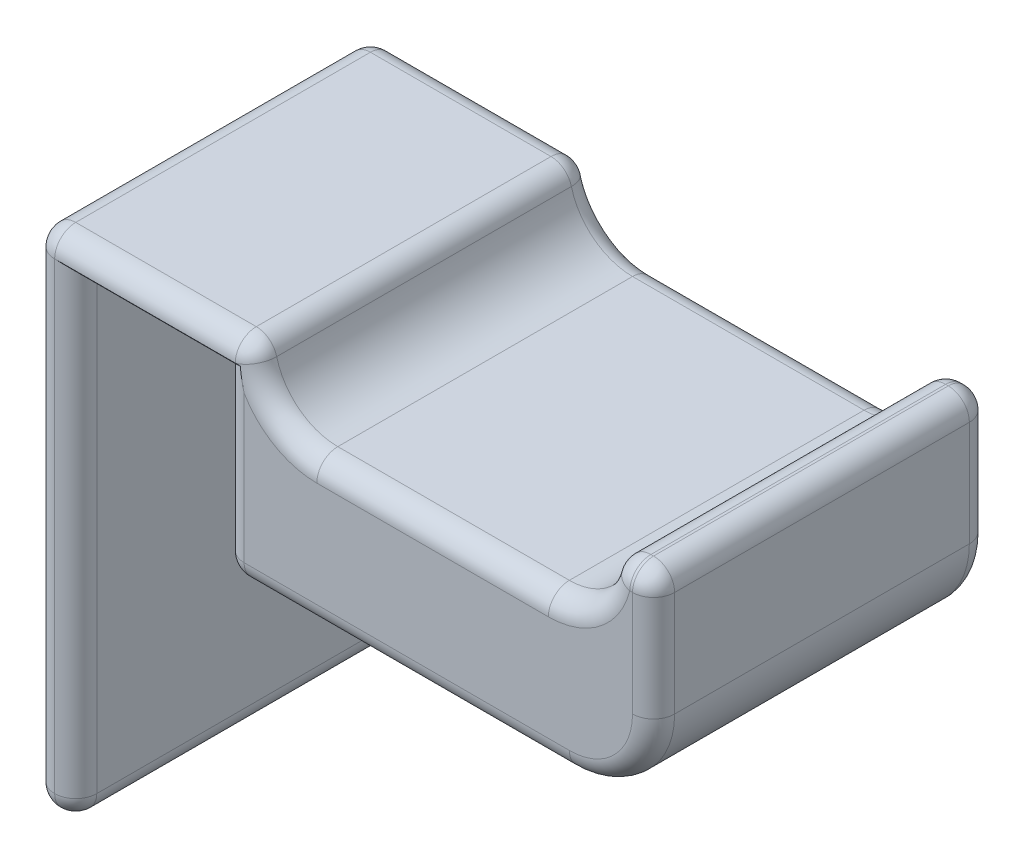
from build123d import *

# Parameters (mm, degrees)
BOSS_EXTRUDE1_DEPTH = 40
FILLET1_R           = 2.5
FILLET2_R           = 2.5
FILLET3_R           = 2.5


with BuildPart() as part:
    # Sketch1 → Boss-Extrude1 (new body)
    with BuildSketch(Plane.XY):
        with BuildLine():
            Line((2.5000000000000173, 0), (21.127950813884276, 0))
            Line((21.127950813884276, 0), (23.945492448365734, 0))
            ThreePointArc((23.945492448365734, 0), (25.47642353760522, -0.5235764623947627), (26.36610703974537, -1.8749999999999996))
            ThreePointArc((26.36610703974537, -1.8749999999999996), (29.035157546165816, -5.92927061281571), (33.627950813884276, -7.5))
            Line((33.627950813884276, -7.5), (61.1279508138843, -7.499999999999999))
            ThreePointArc((61.1279508138843, -7.499999999999999), (65.72074408160276, -5.92927061281571), (68.38979458802321, -1.874999999999998))
            ThreePointArc((68.38979458802321, -1.874999999999998), (69.27947809016335, -0.5235764623947716), (70.81040917940282, 0))
            Line((70.81040917940282, 0), (71.12795081388428, 0))
            ThreePointArc((71.12795081388428, 0), (72.89571776685065, -0.7322330470336298), (73.6279508138843, -2.499999999999995))
            Line((73.6279508138843, -2.499999999999995), (73.6279508138843, -15.000000000000004))
            ThreePointArc((73.6279508138843, -15.000000000000004), (70.69901862574977, -22.07106781186548), (63.6279508138843, -25.000000000000004))
            Line((63.6279508138843, -25.000000000000004), (25.00000000000001, -25.000000000000007))
            ThreePointArc((25.00000000000001, -25.000000000000007), (23.232233047033624, -24.267766952966376), (22.499999999999993, -22.49999999999999))
            Line((22.499999999999993, -22.49999999999999), (22.500000000000004, -3.4999999999999987))
            Line((22.500000000000004, -3.4999999999999987), (4.999999999999997, -3.499999999999996))
            Line((4.999999999999997, -3.499999999999996), (4.999999999999999, -60))
            Line((4.999999999999999, -60), (2.5000000000000178, -60))
            ThreePointArc((2.5000000000000178, -60), (0.7322330470336276, -59.26776695296637), (0, -57.49999999999998))
            Line((0, -57.49999999999998), (0, -2.5000000000000178))
            ThreePointArc((0, -2.5000000000000178), (0.7322330470336309, -0.7322330470336311), (2.5000000000000173, 0))
        make_face()
    extrude(amount=BOSS_EXTRUDE1_DEPTH)

    # Fillet1
    # the kernel refuses this fillet: 2.5 mm, written as the material it takes off along each edge
    with BuildSketch(Plane(origin=(11.25, -60, 40), x_dir=(0, 1, 0), z_dir=(-1, 0, 0))) as fillet1_piece_1:
        with BuildLine():
            CenterArc((FILLET1_R, FILLET1_R), FILLET1_R, 180, 90)
            Line((0, FILLET1_R), (0, 0))
            Line((0, 0), (FILLET1_R, 0))
        make_face()
    extrude(amount=8.749999999999982, mode=Mode.SUBTRACT)
    with BuildSketch(Plane(origin=(24.99999999999999, -22.50000000000001, 0), x_dir=(8.53e-15, -1, 0), z_dir=(1, 8.53e-15, 0))) as fillet1_piece_2:
        with BuildLine():
            CenterArc((2.4999999999999964 - FILLET1_R, -FILLET1_R), FILLET1_R, 0, 90)
            Line((2.4999999999999964 - FILLET1_R, 4.4e-16), (2.4999999999999964, 0))
            Line((2.4999999999999964, 0), (2.4999999999999964, -FILLET1_R))
        make_face()
    revolve(axis=Axis((24.99999999999999, -22.50000000000001, 0), (0, 0, -1)), revolution_arc=90.00000000000098, mode=Mode.SUBTRACT)
    with BuildSketch(Plane(origin=(63.6279508138843, -25.000000000000004, 0), x_dir=(0, 0, 1), z_dir=(-1, -9e-17, 0))) as fillet1_piece_3:
        with BuildLine():
            CenterArc((FILLET1_R, FILLET1_R), FILLET1_R, 180, 90)
            Line((-4.4e-16, FILLET1_R), (0, 0))
            Line((0, 0), (FILLET1_R, 0))
        make_face()
    extrude(amount=38.62795081388428, mode=Mode.SUBTRACT)
    with BuildSketch(Plane(origin=(63.6279508138843, -15.000000000000005, 0), x_dir=(1, 1.8e-16, 0), z_dir=(-1.8e-16, 1, 0))) as fillet1_piece_4:
        with BuildLine():
            CenterArc((10 - FILLET1_R, -FILLET1_R), FILLET1_R, 0, 90)
            Line((10 - FILLET1_R, 4.4e-16), (10, 0))
            Line((10, 0), (10, -FILLET1_R))
        make_face()
    revolve(axis=Axis((63.6279508138843, -15.000000000000005, 0), (0, 0, -1)), revolution_arc=90.00000000000001, mode=Mode.SUBTRACT)
    with BuildSketch(Plane(origin=(73.6279508138843, -2.4999999999999947, 0), x_dir=(0, 0, 1), z_dir=(0, -1, 0))) as fillet1_piece_5:
        with BuildLine():
            CenterArc((FILLET1_R, FILLET1_R), FILLET1_R, 180, 90)
            Line((-4.4e-16, FILLET1_R), (0, 0))
            Line((0, 0), (FILLET1_R, 0))
        make_face()
    extrude(amount=12.500000000000009, mode=Mode.SUBTRACT)
    with BuildSketch(Plane(origin=(2.499999999999992, -57.50000000000001, 40), x_dir=(1.03e-14, -1, 0), z_dir=(1, 1.03e-14, 0))) as fillet1_piece_6:
        with BuildLine():
            CenterArc((2.499999999999993 - FILLET1_R, FILLET1_R), FILLET1_R, 270, 90)
            Line((2.499999999999993, FILLET1_R), (2.499999999999993, 0))
            Line((2.499999999999993, 0), (2.499999999999993 - FILLET1_R, 0))
        make_face()
    revolve(axis=Axis((2.499999999999992, -57.50000000000001, 40), (0, 0, -1)), revolution_arc=90.00000000000125, mode=Mode.SUBTRACT)
    with BuildSketch(Plane(origin=(71.12795081388427, -2.500000000000025, 0), x_dir=(5.68e-15, 1, 0), z_dir=(-1, 5.68e-15, 0))) as fillet1_piece_7:
        with BuildLine():
            CenterArc((2.5000000000000275 - FILLET1_R, -FILLET1_R), FILLET1_R, 0, 90.00000000000003)
            Line((2.5000000000000275 - FILLET1_R, 4.4e-16), (2.5000000000000275, 0))
            Line((2.5000000000000275, 0), (2.500000000000031, -FILLET1_R))
        make_face()
    revolve(axis=Axis((71.12795081388427, -2.500000000000025, 0), (0, 0, -1)), revolution_arc=89.99999999999899, mode=Mode.SUBTRACT)
    with BuildSketch(Plane(origin=(70.81040917940282, 0, 0), x_dir=(0, 0, 1), z_dir=(1, 0, 0))) as fillet1_piece_8:
        with BuildLine():
            CenterArc((FILLET1_R, FILLET1_R), FILLET1_R, 180, 90)
            Line((-4.4e-16, FILLET1_R), (0, 0))
            Line((0, 0), (FILLET1_R, 0))
        make_face()
    extrude(amount=0.3175416344814579, mode=Mode.SUBTRACT)
    with BuildSketch(Plane(origin=(70.81040917940287, -2.500000000000021, 0), x_dir=(-0.9682458365518528, 0.2500000000000059, 0), z_dir=(-0.2500000000000059, -0.9682458365518528, 0))) as fillet1_piece_9:
        with BuildLine():
            CenterArc((2.5000000000000293 - FILLET1_R, -FILLET1_R), FILLET1_R, 0, 89.99999999999999)
            Line((2.5000000000000293 - FILLET1_R, 4.4e-16), (2.5000000000000293, 0))
            Line((2.5000000000000293, 0), (2.5000000000000284, -FILLET1_R))
        make_face()
    revolve(axis=Axis((70.81040917940287, -2.500000000000021, 0), (0, 0, -1)), revolution_arc=75.52248781406874, mode=Mode.SUBTRACT)
    with BuildSketch(Plane(origin=(61.127950813884304, -6.66e-15, 0), x_dir=(-9.5e-16, -1, 0), z_dir=(-1, 9.5e-16, 0))) as fillet1_piece_10:
        with BuildLine():
            CenterArc((7.499999999999993 + FILLET1_R, FILLET1_R), FILLET1_R, 180, 89.99999999999994)
            Line((7.499999999999993 + FILLET1_R, -4.4e-16), (7.499999999999993, 0))
            Line((7.499999999999993, 0), (7.4999999999999964, FILLET1_R))
        make_face()
    revolve(axis=Axis((61.127950813884304, -6.66e-15, 0), (0, 0, 1)), revolution_arc=75.52248781407019, mode=Mode.SUBTRACT)
    with BuildSketch(Plane(origin=(33.627950813884276, -7.5, 0), x_dir=(0, 0, 1), z_dir=(1, 3e-17, 0))) as fillet1_piece_11:
        with BuildLine():
            CenterArc((FILLET1_R, FILLET1_R), FILLET1_R, 180, 90)
            Line((-4.4e-16, FILLET1_R), (0, 0))
            Line((0, 0), (FILLET1_R, 0))
        make_face()
    extrude(amount=27.50000000000002, mode=Mode.SUBTRACT)
    with BuildSketch(Plane(origin=(33.627950813884276, 3.55e-15, 0), x_dir=(-0.9682458365518541, -0.25000000000000033, 0), z_dir=(-0.25000000000000033, 0.9682458365518541, 0))) as fillet1_piece_12:
        with BuildLine():
            CenterArc((7.500000000000004 + FILLET1_R, FILLET1_R), FILLET1_R, 180, 89.99999999999994)
            Line((7.500000000000004 + FILLET1_R, -4.4e-16), (7.500000000000004, 0))
            Line((7.500000000000004, 0), (7.500000000000002, FILLET1_R))
        make_face()
    revolve(axis=Axis((33.627950813884276, 3.55e-15, 0), (0, 0, 1)), revolution_arc=75.52248781407005, mode=Mode.SUBTRACT)
    with BuildSketch(Plane(origin=(23.945492448365737, -2.499999999999996, 0), x_dir=(-1.42e-15, 1, 0), z_dir=(-1, -1.42e-15, 0))) as fillet1_piece_13:
        with BuildLine():
            CenterArc((2.499999999999996 - FILLET1_R, -FILLET1_R), FILLET1_R, 0, 90.00000000000003)
            Line((2.499999999999996 - FILLET1_R, 4.4e-16), (2.499999999999996, 0))
            Line((2.499999999999996, 0), (2.4999999999999956, -FILLET1_R))
        make_face()
    revolve(axis=Axis((23.945492448365737, -2.499999999999996, 0), (0, 0, -1)), revolution_arc=75.52248781407022, mode=Mode.SUBTRACT)
    with BuildSketch(Plane(origin=(23.945492448365734, -2.2e-16, 0), x_dir=(0, 4e-17, 1), z_dir=(-1, 1e-17, 0))) as fillet1_piece_14:
        with BuildLine():
            CenterArc((FILLET1_R, -FILLET1_R), FILLET1_R, 90, 90)
            Line((-5.6e-16, -FILLET1_R), (0, 0))
            Line((0, 0), (FILLET1_R, 0))
        make_face()
    extrude(amount=21.445492448365716, mode=Mode.SUBTRACT)
    with BuildSketch(Plane(origin=(2.499999999999999, -2.499999999999999, 0), x_dir=(-1, -7.46e-15, 0), z_dir=(7.46e-15, -1, 0))) as fillet1_piece_15:
        with BuildLine():
            CenterArc((2.499999999999999 - FILLET1_R, -FILLET1_R), FILLET1_R, 1.018e-14, 90)
            Line((2.4999999999999987, -FILLET1_R), (2.499999999999999, 0))
            Line((2.499999999999999, 0), (2.499999999999999 - FILLET1_R, 0))
        make_face()
    revolve(axis=Axis((2.499999999999999, -2.499999999999999, 0), (0, 0, -1)), revolution_arc=90.00000000000085, mode=Mode.SUBTRACT)
    with BuildSketch(Plane(origin=(0, -57.49999999999998, 40), x_dir=(0, 0, -1), z_dir=(0, 1, 0))) as fillet1_piece_16:
        with BuildLine():
            CenterArc((FILLET1_R, -FILLET1_R), FILLET1_R, 90, 90)
            Line((0, -FILLET1_R), (0, 0))
            Line((0, 0), (FILLET1_R, 0))
        make_face()
    extrude(amount=54.99999999999996, mode=Mode.SUBTRACT)
    with BuildSketch(Plane(origin=(0, -57.49999999999998, 0), x_dir=(0, 0, 1), z_dir=(0, 1, 0))) as fillet1_piece_17:
        with BuildLine():
            CenterArc((FILLET1_R, FILLET1_R), FILLET1_R, 180, 90)
            Line((-4.4e-16, FILLET1_R), (0, 0))
            Line((0, 0), (FILLET1_R, 0))
        make_face()
    extrude(amount=54.99999999999996, mode=Mode.SUBTRACT)
    with BuildSketch(Plane(origin=(2.499999999999992, -57.50000000000001, 0), x_dir=(1.03e-14, -1, 0), z_dir=(1, 1.03e-14, 0))) as fillet1_piece_18:
        with BuildLine():
            CenterArc((2.499999999999993 - FILLET1_R, -FILLET1_R), FILLET1_R, 1.018e-14, 90)
            Line((2.499999999999993, -FILLET1_R), (2.499999999999993, 0))
            Line((2.499999999999993, 0), (2.499999999999993 - FILLET1_R, 0))
        make_face()
    revolve(axis=Axis((2.499999999999992, -57.50000000000001, 0), (0, 0, -1)), revolution_arc=90.00000000000125, mode=Mode.SUBTRACT)
    with BuildSketch(Plane(origin=(11.25, -60, 0), x_dir=(0, 0, 1), z_dir=(-1, 0, 0))) as fillet1_piece_19:
        with BuildLine():
            CenterArc((FILLET1_R, FILLET1_R), FILLET1_R, 180, 90)
            Line((-4.4e-16, FILLET1_R), (0, 0))
            Line((0, 0), (FILLET1_R, 0))
        make_face()
    extrude(amount=8.749999999999982, mode=Mode.SUBTRACT)
    with BuildSketch(Plane(origin=(22.499999999999993, -22.49999999999999, 0), x_dir=(-1.42e-15, 0, 1), z_dir=(5.6e-16, 1, 0))) as fillet1_piece_20:
        with BuildLine():
            CenterArc((FILLET1_R, FILLET1_R), FILLET1_R, 180, 90.00000000000006)
            Line((-4e-15, FILLET1_R), (0, 0))
            Line((0, 0), (FILLET1_R, 0))
        make_face()
    extrude(amount=18.99999999999999, mode=Mode.SUBTRACT)
    with BuildSketch(Plane(origin=(2.499999999999999, -2.499999999999999, 40), x_dir=(-1, -7.46e-15, 0), z_dir=(7.46e-15, -1, 0))) as fillet1_piece_21:
        with BuildLine():
            CenterArc((2.499999999999999 - FILLET1_R, FILLET1_R), FILLET1_R, 270, 90)
            Line((2.4999999999999987, FILLET1_R), (2.499999999999999, 0))
            Line((2.499999999999999, 0), (2.499999999999999 - FILLET1_R, 0))
        make_face()
    revolve(axis=Axis((2.499999999999999, -2.499999999999999, 40), (0, 0, -1)), revolution_arc=90.00000000000085, mode=Mode.SUBTRACT)
    with BuildSketch(Plane(origin=(2.5000000000000178, 0, 40), x_dir=(-1e-17, -1, 0), z_dir=(1, -1e-17, 0))) as fillet1_piece_22:
        with BuildLine():
            CenterArc((FILLET1_R, FILLET1_R), FILLET1_R, 180, 90)
            Line((-1.1e-16, FILLET1_R), (0, 0))
            Line((0, 0), (FILLET1_R, 0))
        make_face()
    extrude(amount=21.445492448365716, mode=Mode.SUBTRACT)
    with BuildSketch(Plane(origin=(23.945492448365737, -2.499999999999996, 40), x_dir=(-1.42e-15, 1, 0), z_dir=(-1, -1.42e-15, 0))) as fillet1_piece_23:
        with BuildLine():
            CenterArc((2.499999999999996 - FILLET1_R, FILLET1_R), FILLET1_R, 270, 90)
            Line((2.499999999999995, FILLET1_R), (2.499999999999996, 0))
            Line((2.499999999999996, 0), (2.499999999999996 - FILLET1_R, 0))
        make_face()
    revolve(axis=Axis((23.945492448365737, -2.499999999999996, 40), (0, 0, -1)), revolution_arc=75.52248781407022, mode=Mode.SUBTRACT)
    with BuildSketch(Plane(origin=(33.627950813884276, 3.55e-15, 40), x_dir=(-0.9682458365518541, -0.25000000000000033, 0), z_dir=(-0.25000000000000033, 0.9682458365518541, 0))) as fillet1_piece_24:
        with BuildLine():
            CenterArc((7.500000000000004 + FILLET1_R, -FILLET1_R), FILLET1_R, 90, 90)
            Line((7.500000000000002, -FILLET1_R), (7.500000000000004, 0))
            Line((7.500000000000004, 0), (7.500000000000004 + FILLET1_R, 0))
        make_face()
    revolve(axis=Axis((33.627950813884276, 3.55e-15, 40), (0, 0, 1)), revolution_arc=75.52248781407005, mode=Mode.SUBTRACT)
    with BuildSketch(Plane(origin=(33.627950813884276, -7.5, 40), x_dir=(3e-17, -1, 0), z_dir=(1, 3e-17, 0))) as fillet1_piece_25:
        with BuildLine():
            CenterArc((FILLET1_R, FILLET1_R), FILLET1_R, 180, 90)
            Line((0, FILLET1_R), (0, 0))
            Line((0, 0), (FILLET1_R, 0))
        make_face()
    extrude(amount=27.50000000000002, mode=Mode.SUBTRACT)
    with BuildSketch(Plane(origin=(22.499999999999993, -22.49999999999999, 40), x_dir=(1, -5.6e-16, 0), z_dir=(5.6e-16, 1, 0))) as fillet1_piece_26:
        with BuildLine():
            CenterArc((FILLET1_R, FILLET1_R), FILLET1_R, 180, 90)
            Line((0, FILLET1_R), (0, 0))
            Line((0, 0), (FILLET1_R, 0))
        make_face()
    extrude(amount=18.99999999999999, mode=Mode.SUBTRACT)
    with BuildSketch(Plane(origin=(61.127950813884304, -6.66e-15, 40), x_dir=(-9.5e-16, -1, 0), z_dir=(-1, 9.5e-16, 0))) as fillet1_piece_27:
        with BuildLine():
            CenterArc((7.499999999999993 + FILLET1_R, -FILLET1_R), FILLET1_R, 90, 90)
            Line((7.499999999999995, -FILLET1_R), (7.499999999999993, 0))
            Line((7.499999999999993, 0), (7.499999999999993 + FILLET1_R, 0))
        make_face()
    revolve(axis=Axis((61.127950813884304, -6.66e-15, 40), (0, 0, 1)), revolution_arc=75.52248781407019, mode=Mode.SUBTRACT)
    with BuildSketch(Plane(origin=(70.81040917940287, -2.500000000000021, 40), x_dir=(-0.9682458365518528, 0.2500000000000059, 0), z_dir=(-0.2500000000000059, -0.9682458365518528, 0))) as fillet1_piece_28:
        with BuildLine():
            CenterArc((2.5000000000000293 - FILLET1_R, FILLET1_R), FILLET1_R, 270, 90)
            Line((2.500000000000029, FILLET1_R), (2.5000000000000293, 0))
            Line((2.5000000000000293, 0), (2.5000000000000293 - FILLET1_R, 0))
        make_face()
    revolve(axis=Axis((70.81040917940287, -2.500000000000021, 40), (0, 0, -1)), revolution_arc=75.52248781406874, mode=Mode.SUBTRACT)
    with BuildSketch(Plane(origin=(70.81040917940282, 0, 40), x_dir=(0, -1, 0), z_dir=(1, 0, 0))) as fillet1_piece_29:
        with BuildLine():
            CenterArc((FILLET1_R, FILLET1_R), FILLET1_R, 180, 90)
            Line((0, FILLET1_R), (0, 0))
            Line((0, 0), (FILLET1_R, 0))
        make_face()
    extrude(amount=0.3175416344814579, mode=Mode.SUBTRACT)
    with BuildSketch(Plane(origin=(71.12795081388427, -2.500000000000025, 40), x_dir=(5.68e-15, 1, 0), z_dir=(-1, 5.68e-15, 0))) as fillet1_piece_30:
        with BuildLine():
            CenterArc((2.5000000000000275 - FILLET1_R, FILLET1_R), FILLET1_R, 270, 90)
            Line((2.500000000000031, FILLET1_R), (2.5000000000000275, 0))
            Line((2.5000000000000275, 0), (2.5000000000000275 - FILLET1_R, 0))
        make_face()
    revolve(axis=Axis((71.12795081388427, -2.500000000000025, 40), (0, 0, -1)), revolution_arc=89.99999999999899, mode=Mode.SUBTRACT)
    with BuildSketch(Plane(origin=(73.6279508138843, -2.4999999999999947, 40), x_dir=(-1, 0, 0), z_dir=(0, -1, 0))) as fillet1_piece_31:
        with BuildLine():
            CenterArc((FILLET1_R, FILLET1_R), FILLET1_R, 180, 90)
            Line((0, FILLET1_R), (0, 0))
            Line((0, 0), (FILLET1_R, 0))
        make_face()
    extrude(amount=12.500000000000009, mode=Mode.SUBTRACT)
    with BuildSketch(Plane(origin=(63.6279508138843, -15.000000000000005, 40), x_dir=(1, 1.8e-16, 0), z_dir=(-1.8e-16, 1, 0))) as fillet1_piece_32:
        with BuildLine():
            CenterArc((10 - FILLET1_R, FILLET1_R), FILLET1_R, 270, 90)
            Line((10, FILLET1_R), (10, 0))
            Line((10, 0), (10 - FILLET1_R, 0))
        make_face()
    revolve(axis=Axis((63.6279508138843, -15.000000000000005, 40), (0, 0, -1)), revolution_arc=90.00000000000001, mode=Mode.SUBTRACT)
    with BuildSketch(Plane(origin=(63.6279508138843, -25.000000000000004, 40), x_dir=(-9e-17, 1, 0), z_dir=(-1, -9e-17, 0))) as fillet1_piece_33:
        with BuildLine():
            CenterArc((FILLET1_R, FILLET1_R), FILLET1_R, 180, 90)
            Line((0, FILLET1_R), (0, 0))
            Line((0, 0), (FILLET1_R, 0))
        make_face()
    extrude(amount=38.62795081388428, mode=Mode.SUBTRACT)
    with BuildSketch(Plane(origin=(24.99999999999999, -22.50000000000001, 40), x_dir=(8.53e-15, -1, 0), z_dir=(1, 8.53e-15, 0))) as fillet1_piece_34:
        with BuildLine():
            CenterArc((2.4999999999999964 - FILLET1_R, FILLET1_R), FILLET1_R, 270, 90)
            Line((2.4999999999999964, FILLET1_R), (2.4999999999999964, 0))
            Line((2.4999999999999964, 0), (2.4999999999999964 - FILLET1_R, 0))
        make_face()
    revolve(axis=Axis((24.99999999999999, -22.50000000000001, 40), (0, 0, -1)), revolution_arc=90.00000000000098, mode=Mode.SUBTRACT)

    # Fillet2
    # the kernel refuses this fillet: 2.5 mm, written as the material it takes off along each edge
    with BuildSketch(Plane(origin=(4.999999999999997, -3.4999999999999964, 0), x_dir=(-1, -3e-17, 0), z_dir=(3e-17, -1, 0))) as fillet2_piece_1:
        with BuildLine():
            CenterArc((FILLET2_R, -FILLET2_R), FILLET2_R, 90, 90)
            Line((-1.78e-15, -FILLET2_R), (-FILLET2_R * 0.02, -FILLET2_R))
            Line((-FILLET2_R * 0.02, -FILLET2_R), (-FILLET2_R * 0.02, FILLET2_R * 0.02))
            Line((-FILLET2_R * 0.02, FILLET2_R * 0.02), (FILLET2_R, FILLET2_R * 0.02))
            Line((FILLET2_R, FILLET2_R * 0.02), (FILLET2_R, 0))
        make_face()
    extrude(amount=54.00000000000001, mode=Mode.SUBTRACT)
    with BuildSketch(Plane(origin=(4.999999999999999, -57.5, 2.5), x_dir=(0, -1, -1.8e-16), z_dir=(0, -1.8e-16, 1))) as fillet2_piece_2:
        with BuildLine():
            CenterArc((2.5 - FILLET2_R, -FILLET2_R), FILLET2_R, 2.036e-14, 90)
            Line((2.5, -FILLET2_R), (2.5 + FILLET2_R * 0.02, -FILLET2_R))
            Line((2.5 + FILLET2_R * 0.02, -FILLET2_R), (2.5 + FILLET2_R * 0.02, FILLET2_R * 0.02))
            Line((2.5 + FILLET2_R * 0.02, FILLET2_R * 0.02), (2.5 - FILLET2_R, FILLET2_R * 0.02))
            Line((2.5 - FILLET2_R, FILLET2_R * 0.02), (2.5 - FILLET2_R, 0))
        make_face()
    revolve(axis=Axis((4.999999999999999, -57.5, 2.5), (1, 0, 0)), revolution_arc=89.99999999999999, mode=Mode.SUBTRACT)
    with BuildSketch(Plane(origin=(4.999999999999999, -60, 2.5), x_dir=(-1, 0, 0), z_dir=(0, 0, 1))) as fillet2_piece_3:
        with BuildLine():
            CenterArc((FILLET2_R, -FILLET2_R), FILLET2_R, 90, 90)
            Line((-8.9e-16, -FILLET2_R), (-FILLET2_R * 0.02, -FILLET2_R))
            Line((-FILLET2_R * 0.02, -FILLET2_R), (-FILLET2_R * 0.02, FILLET2_R * 0.02))
            Line((-FILLET2_R * 0.02, FILLET2_R * 0.02), (FILLET2_R, FILLET2_R * 0.02))
            Line((FILLET2_R, FILLET2_R * 0.02), (FILLET2_R, 0))
        make_face()
    extrude(amount=35, mode=Mode.SUBTRACT)
    with BuildSketch(Plane(origin=(4.999999999999999, -57.5, 37.5), x_dir=(0, 0, 1), z_dir=(0, 1, 0))) as fillet2_piece_4:
        with BuildLine():
            CenterArc((2.5 - FILLET2_R, -FILLET2_R), FILLET2_R, 2.036e-14, 90)
            Line((2.5, -FILLET2_R), (2.5 + FILLET2_R * 0.02, -FILLET2_R))
            Line((2.5 + FILLET2_R * 0.02, -FILLET2_R), (2.5 + FILLET2_R * 0.02, FILLET2_R * 0.02))
            Line((2.5 + FILLET2_R * 0.02, FILLET2_R * 0.02), (2.5 - FILLET2_R, FILLET2_R * 0.02))
            Line((2.5 - FILLET2_R, FILLET2_R * 0.02), (2.5 - FILLET2_R, 0))
        make_face()
    revolve(axis=Axis((4.999999999999999, -57.5, 37.5), (1, 0, 0)), revolution_arc=90, mode=Mode.SUBTRACT)
    with BuildSketch(Plane(origin=(4.9999999999999964, -3.499999999999996, 40), x_dir=(2e-16, 1, 0), z_dir=(1, -2e-16, 0))) as fillet2_piece_5_section:
        with BuildLine():
            CenterArc((2.5000000000000004, -2), FILLET2_R, 126.86989764584406, 53.13010235415594)
            Line((4.4e-16, -2), (-0.04999999999999938, -2))
            Line((-0.04999999999999938, -2), (-0.04999999999999982, 0))
            Line((-0.04999999999999982, 0), (0, 0.04999999999999716))
            ThreePointArc((0, 0.04999999999999716), (0.5000000000000013, 0.04999999999999716), (0.9699999999999984, 0.03999999999999915))
            Line((0.9699999999999984, 0.03999999999999915), (0.9999999999999987, 0))
        make_face()
    fillet2_piece_5 = extrude(amount=24.26045381628627, mode=Mode.PRIVATE)
    fillet2_piece_5 = fillet2_piece_5 - Plane(origin=(25, -3.499999999999996, 37.5), x_dir=(1, 0, 0), z_dir=(0, -1, 0)) * Cylinder(2.5, 57, mode=Mode.PRIVATE)
    add(fillet2_piece_5, mode=Mode.SUBTRACT)
    with BuildSketch(Plane(origin=(4.999999999999997, -3.4999999999999964, 40), x_dir=(-1, -3e-17, 0), z_dir=(3e-17, -1, 0))) as fillet2_piece_6:
        with BuildLine():
            CenterArc((FILLET2_R, FILLET2_R), FILLET2_R, 180, 90)
            Line((-1.78e-15, FILLET2_R), (-FILLET2_R * 0.02, FILLET2_R))
            Line((-FILLET2_R * 0.02, FILLET2_R), (-FILLET2_R * 0.02, -FILLET2_R * 0.02))
            Line((-FILLET2_R * 0.02, -FILLET2_R * 0.02), (FILLET2_R, -FILLET2_R * 0.02))
            Line((FILLET2_R, -FILLET2_R * 0.02), (FILLET2_R, 0))
        make_face()
    extrude(amount=54.00000000000001, mode=Mode.SUBTRACT)
    with BuildSketch(Plane(origin=(4.999999999999997, 2.750000000000007, 40), x_dir=(-1, -3e-17, 0), z_dir=(3e-17, -1, 0))) as fillet2_piece_7a_section:
        with BuildLine():
            CenterArc((FILLET2_R, FILLET2_R), FILLET2_R, 180, 90)
            Line((-1.78e-15, FILLET2_R), (-FILLET2_R * 0.02, FILLET2_R))
            Line((-FILLET2_R * 0.02, FILLET2_R), (-FILLET2_R * 0.02, -FILLET2_R * 0.02))
            Line((-FILLET2_R * 0.02, -FILLET2_R * 0.02), (FILLET2_R, -FILLET2_R * 0.02))
            Line((FILLET2_R, -FILLET2_R * 0.02), (FILLET2_R, 0))
        make_face()
    fillet2_piece_7a = extrude(amount=60.25000000000001, mode=Mode.PRIVATE)
    fillet2_piece_7a = split(fillet2_piece_7a, bisect_by=Plane(origin=(4.9999999999999964, -3.4999999999999964, 40), z_dir=(1.5e-16, 1, 0)), keep=Keep.TOP, mode=Mode.PRIVATE)
    with BuildSketch(Plane(origin=(-1.78e-15, -3.499999999999995, 40), x_dir=(2e-16, 1, 0), z_dir=(1, -2e-16, 0))) as fillet2_piece_7b_section:
        with BuildLine():
            CenterArc((2.5000000000000004, -2), FILLET2_R, 126.86989764584406, 53.13010235415594)
            Line((4.4e-16, -2), (-0.04999999999999938, -2))
            Line((-0.04999999999999938, -2), (-0.04999999999999982, 0))
            Line((-0.04999999999999982, 0), (0, 0.04999999999999716))
            ThreePointArc((0, 0.04999999999999716), (0.5000000000000013, 0.04999999999999716), (0.9699999999999984, 0.03999999999999915))
            Line((0.9699999999999984, 0.03999999999999915), (0.9999999999999987, 0))
        make_face()
    fillet2_piece_7b = extrude(amount=29.260453816286265, mode=Mode.PRIVATE)
    fillet2_piece_7b = split(fillet2_piece_7b, bisect_by=Plane(origin=(4.999999999999997, -3.499999999999995, 40), z_dir=(-1, -3e-17, 0)), keep=Keep.TOP, mode=Mode.PRIVATE)
    fillet2_piece_7 = fillet2_piece_7a & fillet2_piece_7b
    add(fillet2_piece_7, mode=Mode.SUBTRACT)

    # Fillet3
    # the kernel refuses this fillet: 2.5 mm, written as the material it takes off along each edge
    with BuildSketch(Plane(origin=(29.26045381628626, -3.4999999999997757, 0), x_dir=(-9.08e-15, 1, 0), z_dir=(-1, -9.08e-15, 0))) as fillet3_piece_1_section:
        with BuildLine():
            CenterArc((2.4999999999999107, -1.9999999999999982), FILLET3_R, 126.86989764584409, 53.13010235415591)
            Line((-8.926e-14, -1.9999999999999982), (0, 0))
            Line((0, 0), (0.9999999999999081, 0))
        make_face()
    fillet3_piece_1 = extrude(amount=24.21045381628626, mode=Mode.PRIVATE)
    fillet3_piece_1 = fillet3_piece_1 - Plane(origin=(25, -3.4999999999997757, 2.5), x_dir=(0, 0, 1), z_dir=(0, -1, 0)) * Cylinder(2.5, 57, mode=Mode.PRIVATE)
    add(fillet3_piece_1, mode=Mode.SUBTRACT)
    with BuildSketch(Plane(origin=(5.050000000000001, -3.4999999999999956, 0), x_dir=(-9.08e-15, 1, -2.2e-16), z_dir=(-1, -9.08e-15, 0))) as fillet3_piece_2:
        with BuildLine():
            CenterArc((2.499999999999999, -1.9999999999999973), FILLET3_R, 126.86989764584412, 53.13010235415588)
            Line((-8.9e-16, -1.9999999999999967), (0, 0))
            Line((0, 0), (0.9999999999999956, 0))
        make_face()
    extrude(amount=0.05000000000000426, mode=Mode.SUBTRACT)
    with BuildSketch(Plane(origin=(-2.4999999999999982, -3.5, 0), x_dir=(0, 1, 0), z_dir=(1, 0, 0))) as fillet3_piece_3_section:
        with BuildLine():
            CenterArc((2.5, 2), FILLET3_R, 180, 53.13010235415595)
            Line((0, 2), (0, 0))
            Line((0, 0), (1, 0))
        make_face()
    fillet3_piece_3 = extrude(amount=7.4999999999999964, mode=Mode.PRIVATE)
    fillet3_piece_3 = fillet3_piece_3 - Plane(origin=(2.5, -3.5, 2.5), x_dir=(0, 0, 1), z_dir=(0, -1, 0)) * Cylinder(2.5, 23, mode=Mode.PRIVATE)
    add(fillet3_piece_3, mode=Mode.SUBTRACT)


solid = part.part
